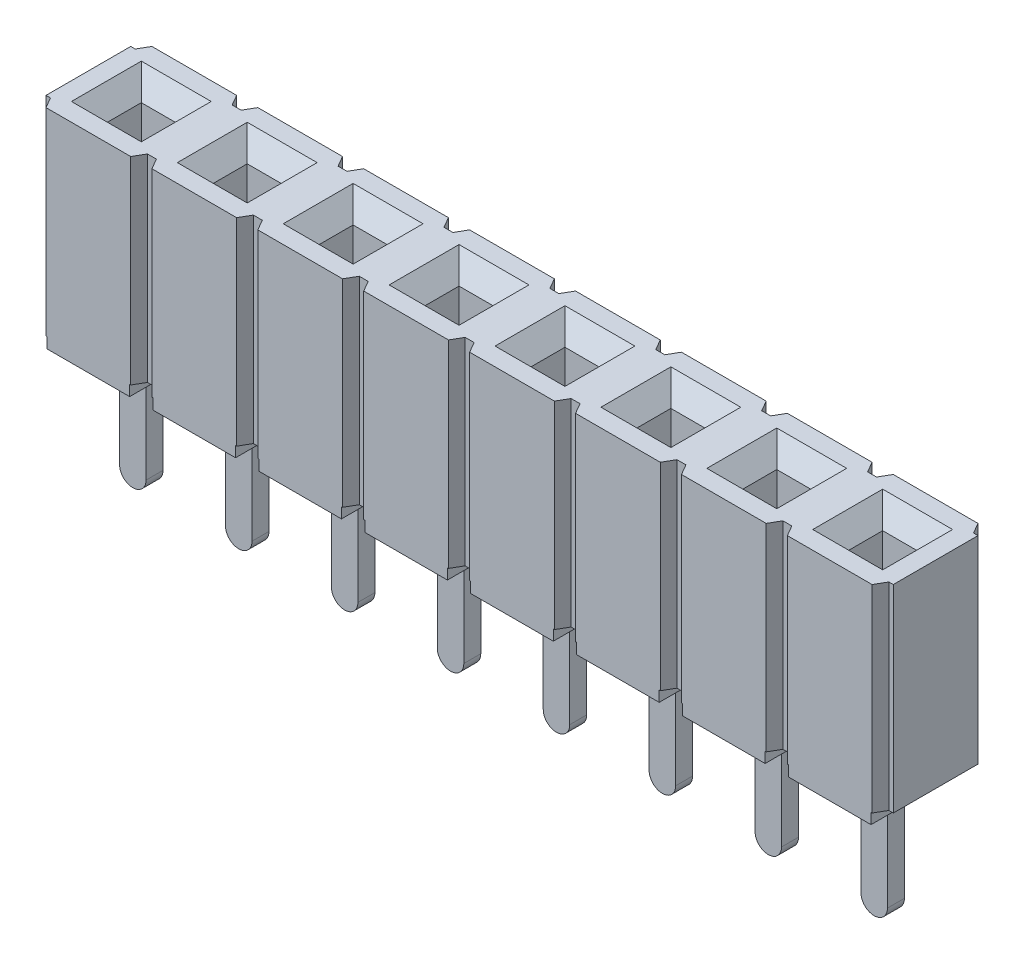
from build123d import *

# Parameters (mm, degrees)
SKETCH1_W                      = 40.64
SKETCH1_H                      = 2.54
BASE_EXTRUDE_DEPTH             = 5
SKETCH2_W                      = 1.524
SKETCH2_H                      = 0.254
STANDOFF_WIDTH_DEPTH           = 41.966114046
UPPER_START                    = -19.4945
UPPER_CORE_OUTLINE_W           = 3.3528
UPPER_CORE_OUTLINE_H           = 0.889
UPPER_CORE_DEPTH               = 0.889
LEAD_IN_SIZE                   = 0.3937
LEAD_IN_SIZE2                  = 0.469193389
CORE_PATTERN_COUNT             = 16
CORE_PATTERN_PITCH             = 2.54
LEAD_IN_OF_CORE_PATTERN_SIZE2  = 0.469193389
LEAD_IN_OF_CORE_PATTERN_SIZE   = 0.3937
POSITION_CUT_DEPTH             = 21.964620197
SKETCH10_W                     = 0.2794
SKETCH10_H                     = 0.254
STANDOFF_LENGTH_DEPTH          = 22.07970588
STANDOFF_PATTERN_COUNT         = 16
STANDOFF_PATTERN_PITCH         = 2.54
SKETCH11_W                     = 0.635
SKETCH11_H                     = 0.4064
TAIL_DEPTH                     = 3.175
TAIL_FILLETS_R                 = 0.3175
TAIL_PATTERN_COUNT             = 16
TAIL_PATTERN_PITCH             = 2.54
TAIL_FILLETS_OF_TAIL_PATTERN_R = 0.3175
SKETCH12_W                     = 20.32
SKETCH12_H                     = 7.921
CUT_EXTRUDE1_DEPTH             = 22.07970588


# Read off the part's stored shape, not the designer's step: Upper Core
with BuildPart() as part:
    # Sketch1 → Base-Extrude (new body)
    with BuildSketch(Plane(origin=(0, 0, 0), x_dir=(1, 0, 0), z_dir=(0, 1, 0))):
        Rectangle(SKETCH1_W, SKETCH1_H)
    extrude(amount=BASE_EXTRUDE_DEPTH)

    # Sketch2 → Standoff - Width (cut, through all)
    with BuildSketch(Plane.ZY.offset(20.32)):
        with Locations((0, 0.127)):
            Rectangle(SKETCH2_W, SKETCH2_H)
    extrude(amount=-STANDOFF_WIDTH_DEPTH, mode=Mode.SUBTRACT)

    # Upper Core outline → Upper Core (cut)
    with BuildSketch(Plane.YZ.offset(UPPER_START)):
        with Locations((3.3236, 0)):
            Rectangle(UPPER_CORE_OUTLINE_W, UPPER_CORE_OUTLINE_H)
    upper_core = extrude(amount=UPPER_CORE_DEPTH, mode=Mode.SUBTRACT)

    # Lead-in
    lead_in_edges = [part.edges().sort_by_distance(p)[0] for p in [
        (-19.4945, 5, 0),
        (-19.05, 5, 0.4445),
        (-18.6055, 5, 0),
        (-19.05, 5, -0.4445),
    ]]
    lead_in_side = [part.faces().sort_by_distance(p)[0] for p in [
        (0.146976854, 5, 0),
    ]]
    chamfer(lead_in_edges, length=LEAD_IN_SIZE, length2=LEAD_IN_SIZE2, reference=lead_in_side[0])

    # Core Pattern: Upper Core ×16
    with Locations(*[(i * CORE_PATTERN_PITCH, 0, 0) for i in range(1, CORE_PATTERN_COUNT)]):
        add(upper_core, mode=Mode.SUBTRACT)

    # Lead-in of Core Pattern
    lead_in_of_core_pattern_edges = [part.edges().sort_by_distance(p)[0] for p in [
        (-16.9545, 5, 0),
        (-16.51, 5, 0.4445),
        (-16.0655, 5, 0),
        (-16.51, 5, -0.4445),
        (-14.4145, 5, 0),
        (-13.97, 5, 0.4445),
        (-13.5255, 5, 0),
        (-13.97, 5, -0.4445),
        (-11.8745, 5, 0),
        (-11.43, 5, 0.4445),
        (-10.9855, 5, 0),
        (-11.43, 5, -0.4445),
        (-9.3345, 5, 0),
        (-8.89, 5, 0.4445),
        (-8.4455, 5, 0),
        (-8.89, 5, -0.4445),
        (-6.7945, 5, 0),
        (-6.35, 5, 0.4445),
        (-5.9055, 5, 0),
        (-6.35, 5, -0.4445),
        (-4.2545, 5, 0),
        (-3.81, 5, 0.4445),
        (-3.3655, 5, 0),
        (-3.81, 5, -0.4445),
        (-1.7145, 5, 0),
        (-1.27, 5, 0.4445),
        (-0.8255, 5, 0),
        (-1.27, 5, -0.4445),
        (0.8255, 5, 0),
        (1.27, 5, 0.4445),
        (1.7145, 5, 0),
        (1.27, 5, -0.4445),
        (3.3655, 5, 0),
        (3.81, 5, 0.4445),
        (4.2545, 5, 0),
        (3.81, 5, -0.4445),
        (5.9055, 5, 0),
        (6.35, 5, 0.4445),
        (6.7945, 5, 0),
        (6.35, 5, -0.4445),
        (8.4455, 5, 0),
        (8.89, 5, 0.4445),
        (9.3345, 5, 0),
        (8.89, 5, -0.4445),
        (10.9855, 5, 0),
        (11.43, 5, 0.4445),
        (11.8745, 5, 0),
        (11.43, 5, -0.4445),
        (13.5255, 5, 0),
        (13.97, 5, 0.4445),
        (14.4145, 5, 0),
        (13.97, 5, -0.4445),
        (16.0655, 5, 0),
        (16.51, 5, 0.4445),
        (16.9545, 5, 0),
        (16.51, 5, -0.4445),
        (18.6055, 5, 0),
        (19.05, 5, 0.4445),
        (19.4945, 5, 0),
        (19.05, 5, -0.4445),
    ]]
    chamfer(lead_in_of_core_pattern_edges, length=LEAD_IN_OF_CORE_PATTERN_SIZE, length2=LEAD_IN_OF_CORE_PATTERN_SIZE2)

    # Sketch4 → Position Cut (cut, through all)
    with BuildSketch(Plane(origin=(0, 5, 0), x_dir=(-1, 0, 0), z_dir=(0, 1, 0))):
        Polygon((20.32, 1.016), (20.212646968, 1.016), (20.066, 1.27), (20.32, 1.27), align=None)
        Polygon((20.066, -1.27), (20.32, -1.27), (20.32, -1.016), (20.212646968, -1.016), align=None)
        Polygon((17.78, -1.016), (17.887353032, -1.016), (18.034, -1.27), (17.78, -1.27), align=None)
        Polygon((18.034, 1.27), (17.78, 1.27), (17.78, 1.016), (17.887353032, 1.016), align=None)
    position_cut = extrude(amount=-POSITION_CUT_DEPTH, mode=Mode.SUBTRACT)

    # Sketch10 → Standoff - Length (cut, through all)
    with BuildSketch(Plane.XY.offset(1.27)):
        with Locations((-17.9197, 0.127)):
            Rectangle(SKETCH10_W, SKETCH10_H)
        with Locations((-20.1803, 0.127)):
            Rectangle(SKETCH10_W, SKETCH10_H)
    standoff_length = extrude(amount=-STANDOFF_LENGTH_DEPTH, mode=Mode.SUBTRACT)

    # Standoff Pattern: Position Cut, Standoff - Length ×16
    with Locations(*[(i * STANDOFF_PATTERN_PITCH, 0, 0) for i in range(1, STANDOFF_PATTERN_COUNT)]):
        add(position_cut, mode=Mode.SUBTRACT)
        add(standoff_length, mode=Mode.SUBTRACT)

    # Sketch11 → Tail (add)
    with BuildSketch(Plane.XZ.offset(-0.254)):
        with Locations((-19.05, 0)):
            Rectangle(SKETCH11_W, SKETCH11_H)
    tail = extrude(amount=TAIL_DEPTH)

    # Tail Fillets
    tail_fillets_edges = [part.edges().sort_by_distance(p)[0] for p in [
        (-19.3675, -2.921, 0),
        (-18.7325, -2.921, 0),
    ]]
    fillet(tail_fillets_edges, radius=TAIL_FILLETS_R - 0.0001)  # a hair under: the kernel refuses the full size

    # Tail Pattern: Tail ×16
    with Locations(*[(i * TAIL_PATTERN_PITCH, 0, 0) for i in range(1, TAIL_PATTERN_COUNT)]):
        add(tail)

    # Tail Fillets of Tail Pattern
    tail_fillets_of_tail_pattern_edges = [part.edges().sort_by_distance(p)[0] for p in [
        (-16.8275, -2.921, 0),
        (-16.1925, -2.921, 0),
        (-14.2875, -2.921, 0),
        (-13.6525, -2.921, 0),
        (-11.7475, -2.921, 0),
        (-11.1125, -2.921, 0),
        (-9.2075, -2.921, 0),
        (-8.5725, -2.921, 0),
        (-6.6675, -2.921, 0),
        (-6.0325, -2.921, 0),
        (-4.1275, -2.921, 0),
        (-3.4925, -2.921, 0),
        (-1.5875, -2.921, 0),
        (-0.9525, -2.921, 0),
        (0.9525, -2.921, 0),
        (1.5875, -2.921, 0),
        (3.4925, -2.921, 0),
        (4.1275, -2.921, 0),
        (6.0325, -2.921, 0),
        (6.6675, -2.921, 0),
        (8.5725, -2.921, 0),
        (9.2075, -2.921, 0),
        (11.1125, -2.921, 0),
        (11.7475, -2.921, 0),
        (13.6525, -2.921, 0),
        (14.2875, -2.921, 0),
        (16.1925, -2.921, 0),
        (16.8275, -2.921, 0),
        (18.7325, -2.921, 0),
        (19.3675, -2.921, 0),
    ]]
    fillet(tail_fillets_of_tail_pattern_edges, radius=TAIL_FILLETS_OF_TAIL_PATTERN_R - 0.0001)  # a hair under: the kernel refuses the full size

    # Sketch12 → Cut-Extrude1 (cut, through all)
    with BuildSketch(Plane.XY.offset(1.27)):
        with Locations((10.16, 1.0395)):
            Rectangle(SKETCH12_W, SKETCH12_H)
    extrude(amount=-CUT_EXTRUDE1_DEPTH, mode=Mode.SUBTRACT)


solid = part.part
